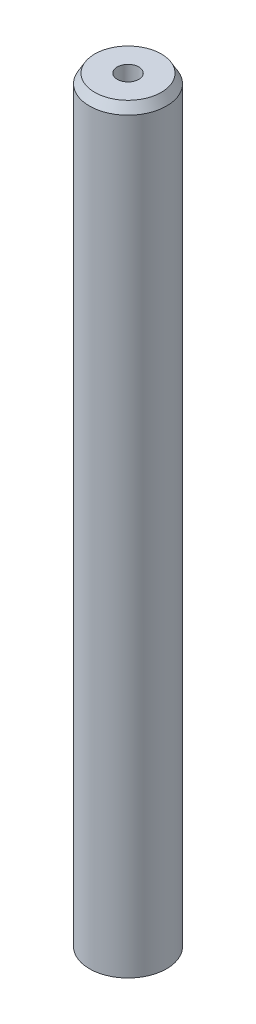
from build123d import *
from OCP.BRepFilletAPI import BRepFilletAPI_MakeChamfer

# Parameters (mm, degrees)
SKETCH1_R           = 5
BOSS_EXTRUDE1_DEPTH = 98.722250548
SKETCH2_R           = 1.399094723
CUT_EXTRUDE1_DEPTH  = 99.975162305
CHAMFER1_SIZE       = 1.187527304
CHAMFER1_SIZE2      = 0.685619209


with BuildPart() as part:
    # Sketch1 → Boss-Extrude1 (new body)
    with BuildSketch(Plane(origin=(0, 0, 0), x_dir=(1, 0, 0), z_dir=(0, 1, 0))):
        Circle(SKETCH1_R)
    extrude(amount=BOSS_EXTRUDE1_DEPTH)

    # Sketch2 → Cut-Extrude1 (cut, through all)
    with BuildSketch(Plane(origin=(0, 0, 0), x_dir=(1, 0, 0), z_dir=(0, 1, 0))):
        Circle(SKETCH2_R)
    extrude(amount=CUT_EXTRUDE1_DEPTH, mode=Mode.SUBTRACT)

    # Chamfer1: one chamfer whose edges measure the first distance from different faces: ONE call of the kernel's chamfer builder (chamfer() names one face for all edges)
    chamfer1_edges_1 = [part.edges().sort_by_distance(p)[0] for p in [
        (-5, 98.722250548, 0),
    ]]
    chamfer1_side_1 = [part.faces().sort_by_distance(p)[0] for p in [
        (-5, 49.361125274, 0),
    ]]
    chamfer1_edges_2 = [part.edges().sort_by_distance(p)[0] for p in [
        (-5, 0, 0),
    ]]
    chamfer1_side_2 = [part.faces().sort_by_distance(p)[0] for p in [
        (-4.858578644, 0, 0),
    ]]
    chamfer1 = BRepFilletAPI_MakeChamfer(part.part.solid().wrapped)
    for e in chamfer1_edges_1:
        chamfer1.Add(CHAMFER1_SIZE, CHAMFER1_SIZE2, e.wrapped, chamfer1_side_1[0].wrapped)  # the first distance lies on this face
    for e in chamfer1_edges_2:
        chamfer1.Add(CHAMFER1_SIZE, CHAMFER1_SIZE2, e.wrapped, chamfer1_side_2[0].wrapped)  # the first distance lies on this face
    add(Compound.cast(chamfer1.Shape()), mode=Mode.REPLACE)


solid = part.part
